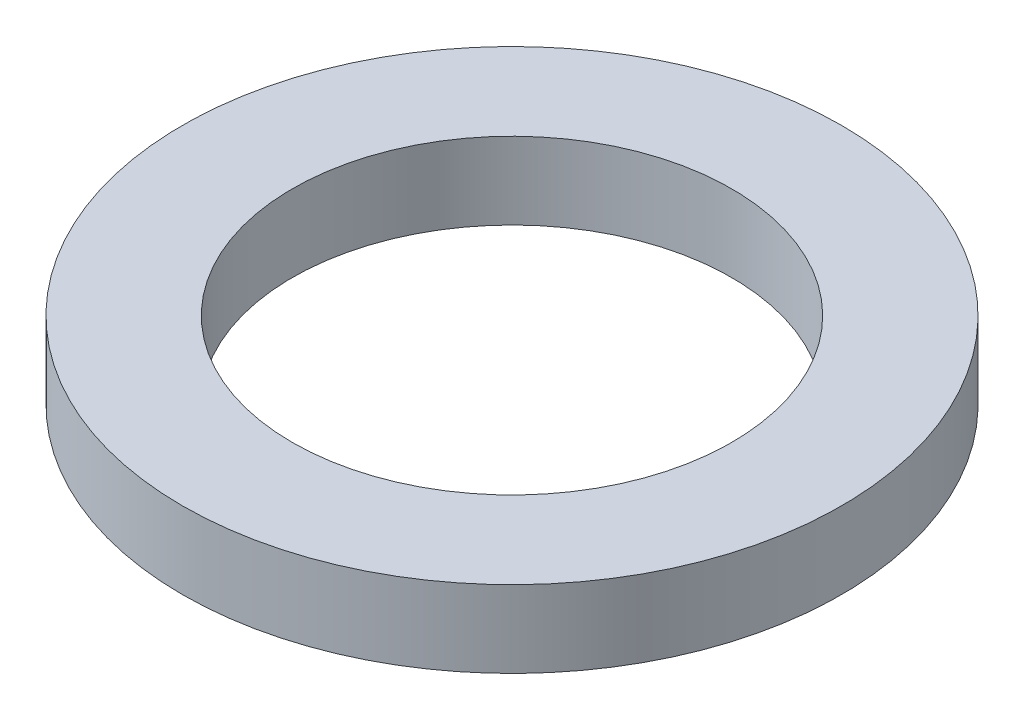
from build123d import *

# Parameters (mm, degrees)
SKETCH1_R           = 30
BOSS_EXTRUDE1_DEPTH = 7
SKETCH2_R           = 20
CUT_EXTRUDE1_DEPTH  = 44


with BuildPart() as part:
    # Sketch1 → Boss-Extrude1 (new body)
    with BuildSketch(Plane(origin=(0, 0, 0), x_dir=(1, 0, 0), z_dir=(0, 1, 0))):
        Circle(SKETCH1_R)
    extrude(amount=BOSS_EXTRUDE1_DEPTH)

    # Sketch2 → Cut-Extrude1 (cut, through all)
    with BuildSketch(Plane(origin=(0, 0, 0), x_dir=(1, 0, 0), z_dir=(0, 1, 0))):
        Circle(SKETCH2_R)
    extrude(amount=CUT_EXTRUDE1_DEPTH, mode=Mode.SUBTRACT)


solid = part.part
